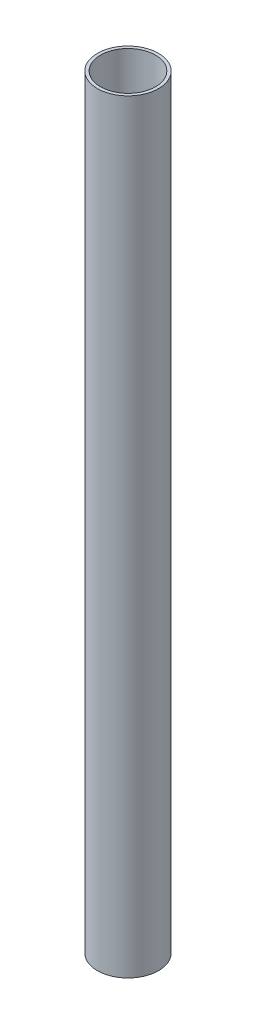
from build123d import *

# Parameters (mm, degrees)
SKETCH1_R           = 10
SKETCH1_R_2         = 9
BOSS_EXTRUDE1_DEPTH = 250


with BuildPart() as part:
    # Sketch1 → Boss-Extrude1 (new body)
    with BuildSketch(Plane(origin=(0, 0, 0), x_dir=(1, 0, 0), z_dir=(0, 1, 0))):
        Circle(SKETCH1_R)
        Circle(SKETCH1_R_2, mode=Mode.SUBTRACT)
    extrude(amount=BOSS_EXTRUDE1_DEPTH)


solid = part.part
